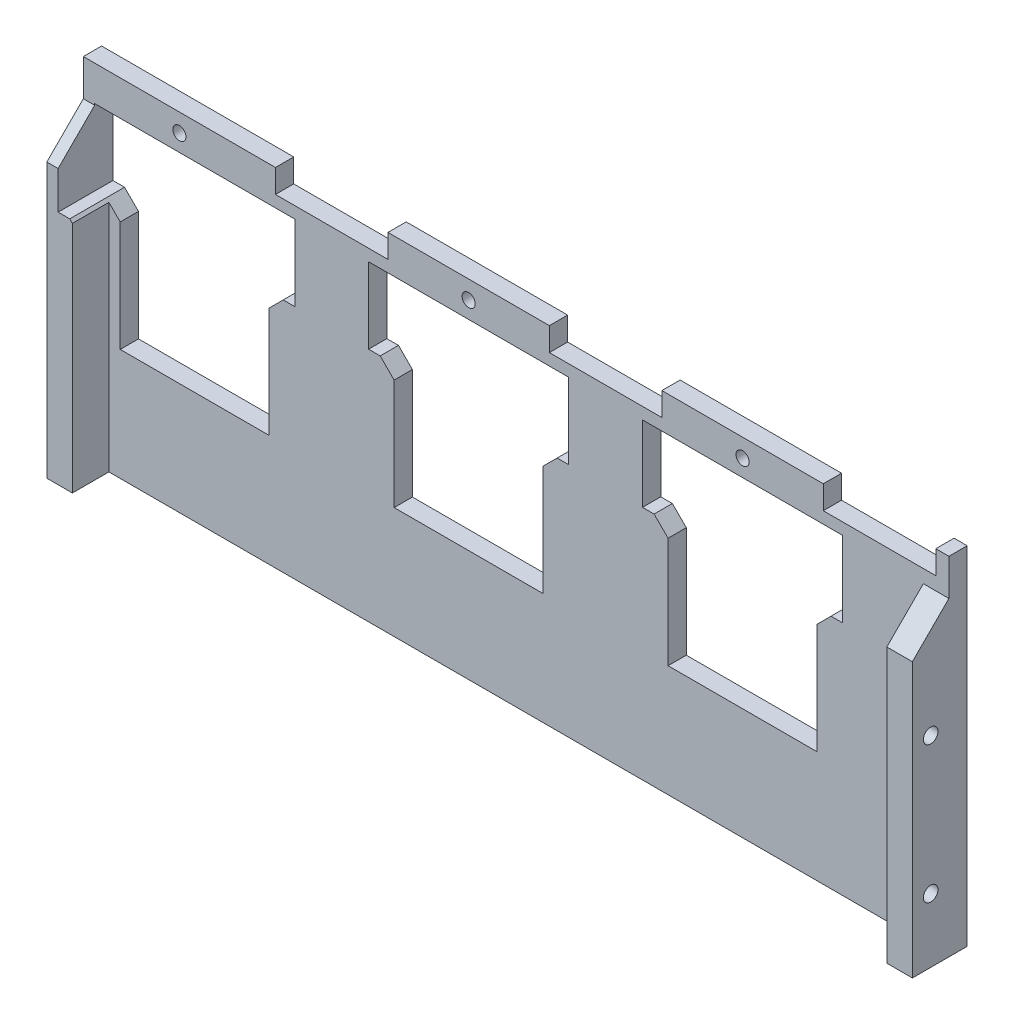
from build123d import *

# Parameters (mm, degrees)
SZKIC1_W                                  = 237
SZKIC1_H                                  = 145
DODANIE_WYCI_GNI_CIE1_DEPTH               = 5
SZKIC2_W                                  = 7
SZKIC2_H                                  = 135
DODANIE_WYCI_GNI_CIE2_DEPTH               = 10
OTW_R_4_0_4_1_D                           = 4
OTW_R_4_0_4_1_DEPTH                       = 6.7
SFAZOWANIE1_SIZE                          = 10
WYTNIJ_WYCI_GNI_CIE1_REACH                = 141.727
SZKIC5_W                                  = 30
SZKIC5_H                                  = 6
POG_BIENIE_WALCOWE_POD_M3_RUB_Z_B_2_COUNT = 2
POG_BIENIE_WALCOWE_POD_M3_RUB_Z_B_2_PITCH = 75
POG_BIENIE_WALCOWE_POD_M3_RUB_Z_B_3_COUNT = 2
POG_BIENIE_WALCOWE_POD_M3_RUB_Z_B_3_PITCH = 154.2


with BuildPart() as part:
    # Szkic1 → Dodanie-wyciągnięcie1 (new body)
    with BuildSketch(Plane.XY):
        Rectangle(SZKIC1_W, SZKIC1_H)
    extrude(amount=DODANIE_WYCI_GNI_CIE1_DEPTH)

    # Szkic2 → Dodanie-wyciągnięcie2 (add)
    with BuildSketch(Plane.XY.offset(5)):
        with Locations((115, -5)):
            Rectangle(SZKIC2_W, SZKIC2_H)
        with Locations((-115, -5)):
            Rectangle(SZKIC2_W, SZKIC2_H)
    extrude(amount=DODANIE_WYCI_GNI_CIE2_DEPTH)

    # Otwór Ø4.0 (4)1
    with Locations(Plane(origin=(118.5, 0, 0), x_dir=(0, 0, -1), z_dir=(1, 0, 0))):
        with Locations((-10, -42.5), (-10, 32.5), (-10, -5)):
            otw_r_4_0_4_1 = Hole(OTW_R_4_0_4_1_D / 2, depth=OTW_R_4_0_4_1_DEPTH)

    # Lustro1: Otwór Ø4.0 (4)1 across plane
    add(otw_r_4_0_4_1.mirror(Plane.ZY), mode=Mode.SUBTRACT)

    # Sfazowanie1
    sfazowanie1_edges = [part.edges().sort_by_distance(p)[0] for p in [
        (-115, 62.5, 15),
        (115, 62.5, 15),
    ]]
    chamfer(sfazowanie1_edges, length=SFAZOWANIE1_SIZE - 0.0001)  # a hair under: the kernel refuses the full size

    # Szkic5 → Wytnij-wyciągnięcie1 (cut, up to next)
    with BuildSketch(Plane(origin=(0, 0, 0), x_dir=(-1, 0, 0), z_dir=(0, 0, -1)), mode=Mode.PRIVATE) as wytnij_wyci_gni_cie1_sk1:
        with Locations((-99.5, 69.5)):
            Rectangle(SZKIC5_W, SZKIC5_H)
    wytnij_wyci_gni_cie1_tool1 = extrude(wytnij_wyci_gni_cie1_sk1.sketch, amount=-WYTNIJ_WYCI_GNI_CIE1_REACH, mode=Mode.PRIVATE) & part.part
    # Szkic5 → Wytnij-wyciągnięcie1 (cut, up to next)
    with BuildSketch(Plane(origin=(0, 0, 0), x_dir=(-1, 0, 0), z_dir=(0, 0, -1)), mode=Mode.PRIVATE) as wytnij_wyci_gni_cie1_sk2:
        Polygon((-84.1, 72.5), (-84.5, 72.5), (-84.5, 66.5), (-114.5, 66.5), (-114.5, 72.5), (-114.9, 72.5), (-114.9, 66.1), (-84.1, 66.1), align=None)
    wytnij_wyci_gni_cie1_tool2 = extrude(wytnij_wyci_gni_cie1_sk2.sketch, amount=-WYTNIJ_WYCI_GNI_CIE1_REACH, mode=Mode.PRIVATE) & part.part
    # Szkic5 → Wytnij-wyciągnięcie1 (cut, up to next)
    with BuildSketch(Plane(origin=(0, 0, 0), x_dir=(-1, 0, 0), z_dir=(0, 0, -1)), mode=Mode.PRIVATE) as wytnij_wyci_gni_cie1_sk3:
        Polygon((-89.4, 62.9), (-89.4, 42.154636006), (-86.220321431, 42.154636006), (-85.282842712, 41.217157288), (-82.4, 38.334314575), (-82.4, 8.1), (-41.6, 8.1), (-41.6, 38.334314575), (-38.717157288, 41.217157288), (-37.779678569, 42.154636006), (-34.6, 42.154636006), (-34.6, 62.9), align=None)
        Polygon((-42, 8.5), (-42, 38.5), (-39, 41.5), (-38, 42.5), (-38, 42.554636006), (-35, 42.554636006), (-35, 62.5), (-89, 62.5), (-89, 42.554636006), (-86, 42.554636006), (-86, 42.5), (-85, 41.5), (-82, 38.5), (-82, 8.5), align=None, mode=Mode.SUBTRACT)
    wytnij_wyci_gni_cie1_tool3 = extrude(wytnij_wyci_gni_cie1_sk3.sketch, amount=-WYTNIJ_WYCI_GNI_CIE1_REACH, mode=Mode.PRIVATE) & part.part
    # Szkic5 → Wytnij-wyciągnięcie1 (cut, up to next)
    with BuildSketch(Plane(origin=(0, 0, 0), x_dir=(-1, 0, 0), z_dir=(0, 0, -1)), mode=Mode.PRIVATE) as wytnij_wyci_gni_cie1_sk4:
        Polygon((-82, 8.5), (-42, 8.5), (-42, 38.5), (-39, 41.5), (-38, 42.5), (-38, 42.554636006), (-35, 42.554636006), (-35, 62.5), (-89, 62.5), (-89, 42.554636006), (-86, 42.554636006), (-86, 42.5), (-85, 41.5), (-82, 38.5), align=None)
    wytnij_wyci_gni_cie1_tool4 = extrude(wytnij_wyci_gni_cie1_sk4.sketch, amount=-WYTNIJ_WYCI_GNI_CIE1_REACH, mode=Mode.PRIVATE) & part.part
    # Szkic5 → Wytnij-wyciągnięcie1 (cut, up to next)
    with BuildSketch(Plane(origin=(0, 0, 0), x_dir=(-1, 0, 0), z_dir=(0, 0, -1)), mode=Mode.PRIVATE) as wytnij_wyci_gni_cie1_sk5:
        Polygon((-14.4, 62.9), (-14.4, 42.154636006), (-11.220321431, 42.154636006), (-10.282842712, 41.217157288), (-7.4, 38.334314575), (-7.4, 8.1), (33.4, 8.1), (33.4, 38.334314575), (36.282842712, 41.217157288), (37.220321431, 42.154636006), (40.4, 42.154636006), (40.4, 62.9), align=None)
        Polygon((33, 8.5), (33, 38.5), (36, 41.5), (37, 42.5), (37, 42.554636006), (40, 42.554636006), (40, 62.5), (-14, 62.5), (-14, 42.554636006), (-11, 42.554636006), (-11, 42.5), (-10, 41.5), (-7, 38.5), (-7, 8.5), align=None, mode=Mode.SUBTRACT)
    wytnij_wyci_gni_cie1_tool5 = extrude(wytnij_wyci_gni_cie1_sk5.sketch, amount=-WYTNIJ_WYCI_GNI_CIE1_REACH, mode=Mode.PRIVATE) & part.part
    # Szkic5 → Wytnij-wyciągnięcie1 (cut, up to next)
    with BuildSketch(Plane(origin=(0, 0, 0), x_dir=(-1, 0, 0), z_dir=(0, 0, -1)), mode=Mode.PRIVATE) as wytnij_wyci_gni_cie1_sk6:
        Polygon((-7, 8.5), (33, 8.5), (33, 38.5), (36, 41.5), (37, 42.5), (37, 42.554636006), (40, 42.554636006), (40, 62.5), (-14, 62.5), (-14, 42.554636006), (-11, 42.554636006), (-11, 42.5), (-10, 41.5), (-7, 38.5), align=None)
    wytnij_wyci_gni_cie1_tool6 = extrude(wytnij_wyci_gni_cie1_sk6.sketch, amount=-WYTNIJ_WYCI_GNI_CIE1_REACH, mode=Mode.PRIVATE) & part.part
    # Szkic5 → Wytnij-wyciągnięcie1 (cut, up to next)
    with BuildSketch(Plane(origin=(0, 0, 0), x_dir=(-1, 0, 0), z_dir=(0, 0, -1)), mode=Mode.PRIVATE) as wytnij_wyci_gni_cie1_sk7:
        with Locations((-24.5, 69.5)):
            Rectangle(SZKIC5_W, SZKIC5_H)
    wytnij_wyci_gni_cie1_tool7 = extrude(wytnij_wyci_gni_cie1_sk7.sketch, amount=-WYTNIJ_WYCI_GNI_CIE1_REACH, mode=Mode.PRIVATE) & part.part
    # Szkic5 → Wytnij-wyciągnięcie1 (cut, up to next)
    with BuildSketch(Plane(origin=(0, 0, 0), x_dir=(-1, 0, 0), z_dir=(0, 0, -1)), mode=Mode.PRIVATE) as wytnij_wyci_gni_cie1_sk8:
        Polygon((-39.5, 72.5), (-39.9, 72.5), (-39.9, 66.1), (-9.1, 66.1), (-9.1, 72.5), (-9.5, 72.5), (-9.5, 66.5), (-39.5, 66.5), align=None)
    wytnij_wyci_gni_cie1_tool8 = extrude(wytnij_wyci_gni_cie1_sk8.sketch, amount=-WYTNIJ_WYCI_GNI_CIE1_REACH, mode=Mode.PRIVATE) & part.part
    # Szkic5 → Wytnij-wyciągnięcie1 (cut, up to next)
    with BuildSketch(Plane(origin=(0, 0, 0), x_dir=(-1, 0, 0), z_dir=(0, 0, -1)), mode=Mode.PRIVATE) as wytnij_wyci_gni_cie1_sk9:
        Polygon((60.6, 62.9), (60.6, 42.154636006), (63.779678569, 42.154636006), (64.717157288, 41.217157288), (67.6, 38.334314575), (67.6, 8.1), (108.4, 8.1), (108.4, 38.334314575), (111.282842712, 41.217157288), (112.220321431, 42.154636006), (115.4, 42.154636006), (115.4, 62.9), align=None)
        Polygon((108, 8.5), (108, 38.5), (111, 41.5), (112, 42.5), (112, 42.554636006), (115, 42.554636006), (115, 62.5), (61, 62.5), (61, 42.554636006), (64, 42.554636006), (64, 42.5), (65, 41.5), (68, 38.5), (68, 8.5), align=None, mode=Mode.SUBTRACT)
    wytnij_wyci_gni_cie1_tool9 = extrude(wytnij_wyci_gni_cie1_sk9.sketch, amount=-WYTNIJ_WYCI_GNI_CIE1_REACH, mode=Mode.PRIVATE) & part.part
    # Szkic5 → Wytnij-wyciągnięcie1 (cut, up to next)
    with BuildSketch(Plane(origin=(0, 0, 0), x_dir=(-1, 0, 0), z_dir=(0, 0, -1)), mode=Mode.PRIVATE) as wytnij_wyci_gni_cie1_sk10:
        Polygon((68, 8.5), (108, 8.5), (108, 38.5), (111, 41.5), (112, 42.5), (112, 42.554636006), (115, 42.554636006), (115, 62.5), (61, 62.5), (61, 42.554636006), (64, 42.554636006), (64, 42.5), (65, 41.5), (68, 38.5), align=None)
    wytnij_wyci_gni_cie1_tool10 = extrude(wytnij_wyci_gni_cie1_sk10.sketch, amount=-WYTNIJ_WYCI_GNI_CIE1_REACH, mode=Mode.PRIVATE) & part.part
    # Szkic5 → Wytnij-wyciągnięcie1 (cut, up to next)
    with BuildSketch(Plane(origin=(0, 0, 0), x_dir=(-1, 0, 0), z_dir=(0, 0, -1)), mode=Mode.PRIVATE) as wytnij_wyci_gni_cie1_sk11:
        with Locations((50.5, 69.5)):
            Rectangle(SZKIC5_W, SZKIC5_H)
    wytnij_wyci_gni_cie1_tool11 = extrude(wytnij_wyci_gni_cie1_sk11.sketch, amount=-WYTNIJ_WYCI_GNI_CIE1_REACH, mode=Mode.PRIVATE) & part.part
    # Szkic5 → Wytnij-wyciągnięcie1 (cut, up to next)
    with BuildSketch(Plane(origin=(0, 0, 0), x_dir=(-1, 0, 0), z_dir=(0, 0, -1)), mode=Mode.PRIVATE) as wytnij_wyci_gni_cie1_sk12:
        Polygon((35.5, 72.5), (35.1, 72.5), (35.1, 66.1), (65.9, 66.1), (65.9, 72.5), (65.5, 72.5), (65.5, 66.5), (35.5, 66.5), align=None)
    wytnij_wyci_gni_cie1_tool12 = extrude(wytnij_wyci_gni_cie1_sk12.sketch, amount=-WYTNIJ_WYCI_GNI_CIE1_REACH, mode=Mode.PRIVATE) & part.part
    add(wytnij_wyci_gni_cie1_tool1.solids().sort_by_distance((99.5, 69.5, 0))[0], mode=Mode.SUBTRACT)
    add(wytnij_wyci_gni_cie1_tool2.solids().sort_by_distance((84.3, 72.185421, 0))[0], mode=Mode.SUBTRACT)
    add(wytnij_wyci_gni_cie1_tool3.solids().sort_by_distance((89.322501, 52.527318, 0))[0], mode=Mode.SUBTRACT)
    add(wytnij_wyci_gni_cie1_tool4.solids().sort_by_distance((62, 37.474353, 0))[0], mode=Mode.SUBTRACT)
    add(wytnij_wyci_gni_cie1_tool5.solids().sort_by_distance((14.322501, 52.527318, 0))[0], mode=Mode.SUBTRACT)
    add(wytnij_wyci_gni_cie1_tool6.solids().sort_by_distance((-13, 37.474353, 0))[0], mode=Mode.SUBTRACT)
    add(wytnij_wyci_gni_cie1_tool7.solids().sort_by_distance((24.5, 69.5, 0))[0], mode=Mode.SUBTRACT)
    add(wytnij_wyci_gni_cie1_tool8.solids().sort_by_distance((39.7, 72.185421, 0))[0], mode=Mode.SUBTRACT)
    add(wytnij_wyci_gni_cie1_tool9.solids().sort_by_distance((-60.677499, 52.527318, 0))[0], mode=Mode.SUBTRACT)
    add(wytnij_wyci_gni_cie1_tool10.solids().sort_by_distance((-88, 37.474353, 0))[0], mode=Mode.SUBTRACT)
    add(wytnij_wyci_gni_cie1_tool11.solids().sort_by_distance((-50.5, 69.5, 0))[0], mode=Mode.SUBTRACT)
    add(wytnij_wyci_gni_cie1_tool12.solids().sort_by_distance((-65.814579, 69.5, 0))[0], mode=Mode.SUBTRACT)


with BuildPart() as body_2:
    # Podziel1: the piece on the far side of the plane
    add(part.part)
    split(bisect_by=Plane(origin=(0, -22.5, 0), x_dir=(0, 0, -1), z_dir=(0, -1, 0)), keep=Keep.BOTTOM)

    # Szkic7 → Pogłębienie walcowe pod M3 Śrubę z łbem stożkowym ściętym1 (revolve, cut)
    with BuildSketch(Plane(origin=(62, 67.5, 0), x_dir=(0, 1, 0), z_dir=(1, 0, 0))):
        Polygon((0, 0), (0, 7.781549114), (1.8, 6.7), (1.8, 2.4), (3.5, 2.4), (3.5, 0), align=None)
    pog_bienie_walcowe_pod_m3_rub_z_bem_s = revolve(axis=Axis((62, 67.5, -6.35), (0, 0, 1)), mode=Mode.SUBTRACT)

    # Pog_bienie walcowe pod M3 _rub_ z _b 2: Pogłębienie walcowe pod M3 Śrubę z łbem stożkowym ściętym1 ×2
    with Locations(*[(-i * POG_BIENIE_WALCOWE_POD_M3_RUB_Z_B_2_PITCH, 0, 0) for i in range(1, POG_BIENIE_WALCOWE_POD_M3_RUB_Z_B_2_COUNT)]):
        add(pog_bienie_walcowe_pod_m3_rub_z_bem_s, mode=Mode.SUBTRACT)

    # Pog_bienie walcowe pod M3 _rub_ z _b 3: Pogłębienie walcowe pod M3 Śrubę z łbem stożkowym ściętym1 ×2
    with Locations(*[(-i * POG_BIENIE_WALCOWE_POD_M3_RUB_Z_B_3_PITCH, 0, 0) for i in range(1, POG_BIENIE_WALCOWE_POD_M3_RUB_Z_B_3_COUNT)]):
        add(pog_bienie_walcowe_pod_m3_rub_z_bem_s, mode=Mode.SUBTRACT)


with BuildPart() as part_1:
    add(part.part)

    # Podziel1
    split(bisect_by=Plane(origin=(0, -22.5, 0), x_dir=(0, 0, -1), z_dir=(0, -1, 0)), keep=Keep.TOP)


solid = body_2.part
